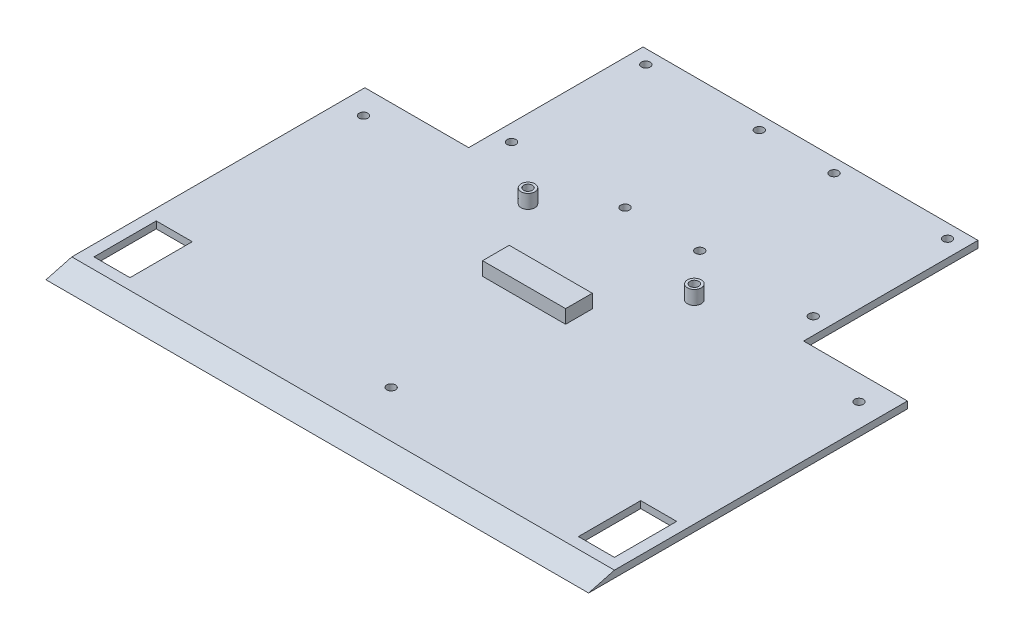
from build123d import *

# Parameters (mm, degrees)
SALIENTE_EXTRUIR1_DEPTH = 196
CORTAR_EXTRUIR1_REACH   = 266.89
CROQUIS2_W              = 37.5
CROQUIS2_H              = 62.989872981
CORTAR_EXTRUIR2_REACH   = 266.89
CROQUIS4_W              = 13
CROQUIS4_H              = 22.5
CUT_EXTRUDE1_REACH      = 266.89
SKETCH1_R               = 1.585
CUT_EXTRUDE2_REACH      = 266.89
SKETCH2_R               = 1.585
CUT_EXTRUDE3_REACH      = 266.89
SKETCH3_R               = 1.585
SKETCH4_R               = 2.5
SKETCH4_R_2             = 1.6
BOSS_EXTRUDE1_DEPTH     = 5
SKETCH5_W               = 30
SKETCH5_H               = 9.637731071
BOSS_EXTRUDE2_DEPTH     = 4.9
CUT_EXTRUDE4_START      = -4.9
SKETCH6_R               = 1.6
CUT_EXTRUDE4_DEPTH      = 4.9


with BuildPart() as part:
    # Croquis1 → Saliente-Extruir1 (new body)
    with BuildSketch(Plane(origin=(0, 0, 0), x_dir=(0, 0, -1), z_dir=(1, 0, 0))):
        Polygon((0, 0), (178.17, 0), (178.17, 2.5), (9.330127019, 2.5), align=None)
    extrude(amount=SALIENTE_EXTRUIR1_DEPTH)

    # Croquis2 → Cortar-Extruir1 (cut, up to next)
    with BuildSketch(Plane(origin=(0, 0, 0), x_dir=(-1, 0, 0), z_dir=(0, -1, 0)), mode=Mode.PRIVATE) as cortar_extruir1_sk1:
        with Locations((-18.75, 146.67506351)):
            Rectangle(CROQUIS2_W, CROQUIS2_H)
    cortar_extruir1_tool1 = extrude(cortar_extruir1_sk1.sketch, amount=-CORTAR_EXTRUIR1_REACH, mode=Mode.PRIVATE) & part.part
    # Croquis2 → Cortar-Extruir1 (cut, up to next)
    with BuildSketch(Plane(origin=(0, 0, 0), x_dir=(-1, 0, 0), z_dir=(0, -1, 0)), mode=Mode.PRIVATE) as cortar_extruir1_sk2:
        with Locations((-177.25, 146.67506351)):
            Rectangle(CROQUIS2_W, CROQUIS2_H)
    cortar_extruir1_tool2 = extrude(cortar_extruir1_sk2.sketch, amount=-CORTAR_EXTRUIR1_REACH, mode=Mode.PRIVATE) & part.part
    add(cortar_extruir1_tool1.solids().sort_by_distance((18.75, 0, -146.675064))[0], mode=Mode.SUBTRACT)
    add(cortar_extruir1_tool2.solids().sort_by_distance((177.25, 0, -146.675064))[0], mode=Mode.SUBTRACT)

    # Croquis4 → Cortar-Extruir2 (cut, up to next)
    with BuildSketch(Plane(origin=(0, 2.5, 0), x_dir=(1, 0, 0), z_dir=(0, 1, 0)), mode=Mode.PRIVATE) as cortar_extruir2_sk1:
        with Locations((10.5, 24.580127019)):
            Rectangle(CROQUIS4_W, CROQUIS4_H)
    cortar_extruir2_tool1 = extrude(cortar_extruir2_sk1.sketch, amount=-CORTAR_EXTRUIR2_REACH, mode=Mode.PRIVATE) & part.part
    cortar_extruir2 = cortar_extruir2_tool1.solids().sort_by_distance((10.5, 2.5, -24.580127))[0]
    add(cortar_extruir2, mode=Mode.SUBTRACT)

    # Simetría1: Cortar-Extruir2 across plane
    add(cortar_extruir2.mirror(Plane(origin=(98, 0, 0), x_dir=(0, 0, 1), z_dir=(1, 0, 0))), mode=Mode.SUBTRACT)

    # Sketch1 → Cut-Extrude1 (cut, up to next)
    with BuildSketch(Plane(origin=(0, 2.5, 0), x_dir=(1, 0, 0), z_dir=(0, 1, 0)), mode=Mode.PRIVATE) as cut_extrude1_sk1:
        with Locations((187.5, 106.180127019)):
            Circle(SKETCH1_R)
    cut_extrude1_tool1 = extrude(cut_extrude1_sk1.sketch, amount=-CUT_EXTRUDE1_REACH, mode=Mode.PRIVATE) & part.part
    # Sketch1 → Cut-Extrude1 (cut, up to next)
    with BuildSketch(Plane(origin=(0, 2.5, 0), x_dir=(1, 0, 0), z_dir=(0, 1, 0)), mode=Mode.PRIVATE) as cut_extrude1_sk2:
        with Locations((8.5, 106.180127019)):
            Circle(SKETCH1_R)
    cut_extrude1_tool2 = extrude(cut_extrude1_sk2.sketch, amount=-CUT_EXTRUDE1_REACH, mode=Mode.PRIVATE) & part.part
    add(cut_extrude1_tool1.solids().sort_by_distance((187.5, 2.5, -106.180127))[0], mode=Mode.SUBTRACT)
    add(cut_extrude1_tool2.solids().sort_by_distance((8.5, 2.5, -106.180127))[0], mode=Mode.SUBTRACT)

    # Sketch2 → Cut-Extrude2 (cut, up to next)
    with BuildSketch(Plane(origin=(0, 2.5, 0), x_dir=(1, 0, 0), z_dir=(0, 1, 0)), mode=Mode.PRIVATE) as cut_extrude2_sk1:
        with Locations((98.5, 26.180127019)):
            Circle(SKETCH2_R)
    cut_extrude2_tool1 = extrude(cut_extrude2_sk1.sketch, amount=-CUT_EXTRUDE2_REACH, mode=Mode.PRIVATE) & part.part
    add(cut_extrude2_tool1.solids().sort_by_distance((98.5, 2.5, -26.180127))[0], mode=Mode.SUBTRACT)

    # Sketch3 → Cut-Extrude3 (cut, up to next)
    with BuildSketch(Plane(origin=(0, 2.5, 0), x_dir=(1, 0, 0), z_dir=(0, 1, 0)), mode=Mode.PRIVATE) as cut_extrude3_sk1:
        with Locations((111.5, 124.67)):
            Circle(SKETCH3_R)
    cut_extrude3_tool1 = extrude(cut_extrude3_sk1.sketch, amount=-CUT_EXTRUDE3_REACH, mode=Mode.PRIVATE) & part.part
    # Sketch3 → Cut-Extrude3 (cut, up to next)
    with BuildSketch(Plane(origin=(0, 2.5, 0), x_dir=(1, 0, 0), z_dir=(0, 1, 0)), mode=Mode.PRIVATE) as cut_extrude3_sk2:
        with Locations((152.5, 124.67)):
            Circle(SKETCH3_R)
    cut_extrude3_tool2 = extrude(cut_extrude3_sk2.sketch, amount=-CUT_EXTRUDE3_REACH, mode=Mode.PRIVATE) & part.part
    # Sketch3 → Cut-Extrude3 (cut, up to next)
    with BuildSketch(Plane(origin=(0, 2.5, 0), x_dir=(1, 0, 0), z_dir=(0, 1, 0)), mode=Mode.PRIVATE) as cut_extrude3_sk3:
        with Locations((152.5, 173.17)):
            Circle(SKETCH3_R)
    cut_extrude3_tool3 = extrude(cut_extrude3_sk3.sketch, amount=-CUT_EXTRUDE3_REACH, mode=Mode.PRIVATE) & part.part
    # Sketch3 → Cut-Extrude3 (cut, up to next)
    with BuildSketch(Plane(origin=(0, 2.5, 0), x_dir=(1, 0, 0), z_dir=(0, 1, 0)), mode=Mode.PRIVATE) as cut_extrude3_sk4:
        with Locations((111.5, 173.17)):
            Circle(SKETCH3_R)
    cut_extrude3_tool4 = extrude(cut_extrude3_sk4.sketch, amount=-CUT_EXTRUDE3_REACH, mode=Mode.PRIVATE) & part.part
    # Sketch3 → Cut-Extrude3 (cut, up to next)
    with BuildSketch(Plane(origin=(0, 2.5, 0), x_dir=(1, 0, 0), z_dir=(0, 1, 0)), mode=Mode.PRIVATE) as cut_extrude3_sk5:
        with Locations((84.5, 173.17)):
            Circle(SKETCH3_R)
    cut_extrude3_tool5 = extrude(cut_extrude3_sk5.sketch, amount=-CUT_EXTRUDE3_REACH, mode=Mode.PRIVATE) & part.part
    # Sketch3 → Cut-Extrude3 (cut, up to next)
    with BuildSketch(Plane(origin=(0, 2.5, 0), x_dir=(1, 0, 0), z_dir=(0, 1, 0)), mode=Mode.PRIVATE) as cut_extrude3_sk6:
        with Locations((43.5, 173.17)):
            Circle(SKETCH3_R)
    cut_extrude3_tool6 = extrude(cut_extrude3_sk6.sketch, amount=-CUT_EXTRUDE3_REACH, mode=Mode.PRIVATE) & part.part
    # Sketch3 → Cut-Extrude3 (cut, up to next)
    with BuildSketch(Plane(origin=(0, 2.5, 0), x_dir=(1, 0, 0), z_dir=(0, 1, 0)), mode=Mode.PRIVATE) as cut_extrude3_sk7:
        with Locations((43.5, 124.67)):
            Circle(SKETCH3_R)
    cut_extrude3_tool7 = extrude(cut_extrude3_sk7.sketch, amount=-CUT_EXTRUDE3_REACH, mode=Mode.PRIVATE) & part.part
    # Sketch3 → Cut-Extrude3 (cut, up to next)
    with BuildSketch(Plane(origin=(0, 2.5, 0), x_dir=(1, 0, 0), z_dir=(0, 1, 0)), mode=Mode.PRIVATE) as cut_extrude3_sk8:
        with Locations((84.5, 124.67)):
            Circle(SKETCH3_R)
    cut_extrude3_tool8 = extrude(cut_extrude3_sk8.sketch, amount=-CUT_EXTRUDE3_REACH, mode=Mode.PRIVATE) & part.part
    add(cut_extrude3_tool1.solids().sort_by_distance((111.5, 2.5, -124.67))[0], mode=Mode.SUBTRACT)
    add(cut_extrude3_tool2.solids().sort_by_distance((152.5, 2.5, -124.67))[0], mode=Mode.SUBTRACT)
    add(cut_extrude3_tool3.solids().sort_by_distance((152.5, 2.5, -173.17))[0], mode=Mode.SUBTRACT)
    add(cut_extrude3_tool4.solids().sort_by_distance((111.5, 2.5, -173.17))[0], mode=Mode.SUBTRACT)
    add(cut_extrude3_tool5.solids().sort_by_distance((84.5, 2.5, -173.17))[0], mode=Mode.SUBTRACT)
    add(cut_extrude3_tool6.solids().sort_by_distance((43.5, 2.5, -173.17))[0], mode=Mode.SUBTRACT)
    add(cut_extrude3_tool7.solids().sort_by_distance((43.5, 2.5, -124.67))[0], mode=Mode.SUBTRACT)
    add(cut_extrude3_tool8.solids().sort_by_distance((84.5, 2.5, -124.67))[0], mode=Mode.SUBTRACT)

    # Sketch4 → Boss-Extrude1 (add)
    # profile 1 of 2: a face of its own
    with BuildSketch(Plane(origin=(0, 2.5, 0), x_dir=(1, 0, 0), z_dir=(0, 1, 0))):
        with Locations((65.776416732, 108.336862559)):
            Circle(SKETCH4_R)
        with Locations((65.776416732, 108.336862559)):
            Circle(SKETCH4_R_2, mode=Mode.SUBTRACT)
    # profile 2 of 2: a face of its own
    with BuildSketch(Plane(origin=(0, 2.5, 0), x_dir=(1, 0, 0), z_dir=(0, 1, 0))):
        with Locations((125.876416732, 108.336862559)):
            Circle(SKETCH4_R)
        with Locations((125.876416732, 108.336862559)):
            Circle(SKETCH4_R_2, mode=Mode.SUBTRACT)
    extrude(amount=BOSS_EXTRUDE1_DEPTH)

    # Sketch5 → Boss-Extrude2 (add)
    with BuildSketch(Plane(origin=(0, 2.5, 0), x_dir=(1, 0, 0), z_dir=(0, 1, 0))):
        with Locations((95.271957283, 82.2427394)):
            Rectangle(SKETCH5_W, SKETCH5_H)
    extrude(amount=BOSS_EXTRUDE2_DEPTH)

    # Sketch6 → Cut-Extrude4 (cut)
    with BuildSketch(Plane(origin=(0, 2.5, 0), x_dir=(1, 0, 0), z_dir=(0, 1, 0)).offset(CUT_EXTRUDE4_START)):
        with Locations((125.876416732, 108.336862559)):
            Circle(SKETCH6_R)
        with Locations((65.776416732, 108.336862559)):
            Circle(SKETCH6_R)
    extrude(amount=CUT_EXTRUDE4_DEPTH, mode=Mode.SUBTRACT)


solid = part.part
